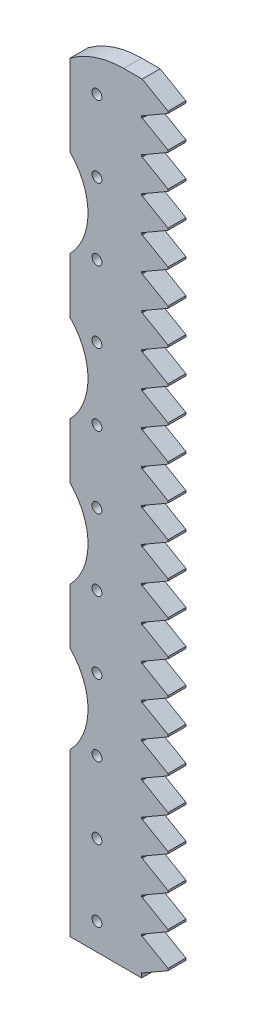
from build123d import *

# Parameters (mm, degrees)
SKETCH1_W           = 25.4
SKETCH1_H           = 276.225
BOSS_EXTRUDE1_DEPTH = 6.35
CUT_EXTRUDE1_DEPTH  = 278.463030195
SKETCH3_R           = 1.75
CUT_EXTRUDE2_DEPTH  = 278.463030195
LPATTERN1_COUNT     = 11
LPATTERN1_PITCH     = 25.4
SKETCH4_R           = 22.225
CUT_EXTRUDE3_DEPTH  = 278.463030195
LPATTERN2_COUNT     = 4
LPATTERN2_PITCH     = 50.8
BOSS_EXTRUDE2_DEPTH = 6.35
LPATTERN3_START     = -5e-05
LPATTERN3_DEPTH     = 6.35005


# Read off the part's stored shape, not the designer's step: LPattern3
with BuildPart() as part:
    # Sketch1 → Boss-Extrude1 (new body)
    with BuildSketch(Plane.XY):
        with Locations((-12.7, 138.1125)):
            Rectangle(SKETCH1_W, SKETCH1_H)
    extrude(amount=BOSS_EXTRUDE1_DEPTH)

    # Sketch2 → Cut-Extrude1 (cut, through all)
    with BuildSketch(Plane.XY.offset(6.35)):
        with BuildLine():
            Line((-6.35, 276.225), (-25.4, 276.225))
            Line((-25.4, 276.225), (-25.4, 269.875))
            ThreePointArc((-25.4, 269.875), (-16.390231571, 274.595694713), (-6.35, 276.225))
        make_face()
    extrude(amount=-CUT_EXTRUDE1_DEPTH, mode=Mode.SUBTRACT)

    # Sketch3 → Cut-Extrude2 (cut, through all)
    with BuildSketch(Plane.XY.offset(6.35)):
        with Locations((-15.875, 263.525)):
            Circle(SKETCH3_R)
    cut_extrude2 = extrude(amount=-CUT_EXTRUDE2_DEPTH, mode=Mode.SUBTRACT)

    # LPattern1: Cut-Extrude2 ×11
    with Locations(*[(0, -i * LPATTERN1_PITCH, 0) for i in range(1, LPATTERN1_COUNT)]):
        add(cut_extrude2, mode=Mode.SUBTRACT)

    # Sketch4 → Cut-Extrude3 (cut, through all)
    with BuildSketch(Plane.XY.offset(6.35)):
        with Locations((-41.275, 225.425)):
            Circle(SKETCH4_R)
    cut_extrude3 = extrude(amount=-CUT_EXTRUDE3_DEPTH, mode=Mode.SUBTRACT)

    # LPattern2: Cut-Extrude3 ×4
    with Locations(*[(0, -i * LPATTERN2_PITCH, 0) for i in range(1, LPATTERN2_COUNT)]):
        add(cut_extrude3, mode=Mode.SUBTRACT)

    # Sketch5 → Boss-Extrude2 (add, through all)
    with BuildSketch(Plane.XY.offset(6.35)):
        Polygon((0.1905, 276.225), (9.3345, 270.945709139), (9.3345, 270.240265995), (0.1905, 264.960975133), (0, 264.960975133), (0, 276.225), align=None)
    extrude(amount=-BOSS_EXTRUDE2_DEPTH)

    # LPattern3 outline → LPattern3 (add)
    with BuildSketch(Plane.XY.offset(LPATTERN3_START)):
        Polygon((0.1905, 252.991507123), (9.3345, 258.270797985), (9.3345, 258.976241128), (0.1905, 264.25553199), (0, 264.25553199), (0, 252.991507123), align=None)
        Polygon((0.1905, 12.896703776), (0, 12.896703776), (0, 1.63267891), (0.1905, 1.63267891), (9.3345, 6.911969771), (9.3345, 7.617412915), align=None)
        Polygon((0.1905, 24.866171786), (0, 24.866171786), (0, 13.60214692), (0.1905, 13.60214692), (9.3345, 18.881437781), (9.3345, 19.586880925), align=None)
        Polygon((0.1905, 36.835639796), (0, 36.835639796), (0, 25.57161493), (0.1905, 25.57161493), (9.3345, 30.850905791), (9.3345, 31.556348935), align=None)
        Polygon((0.1905, 48.805107807), (0, 48.805107807), (0, 37.54108294), (0.1905, 37.54108294), (9.3345, 42.820373802), (9.3345, 43.525816945), align=None)
        Polygon((0.1905, 60.774575817), (0, 60.774575817), (0, 49.51055095), (0.1905, 49.51055095), (9.3345, 54.789841812), (9.3345, 55.495284955), align=None)
        Polygon((0.1905, 72.744043827), (0, 72.744043827), (0, 61.48001896), (0.1905, 61.48001896), (9.3345, 66.759309822), (9.3345, 67.464752966), align=None)
        Polygon((0.1905, 84.713511837), (0, 84.713511837), (0, 73.449486971), (0.1905, 73.449486971), (9.3345, 78.728777832), (9.3345, 79.434220976), align=None)
        Polygon((0.1905, 96.682979847), (0, 96.682979847), (0, 85.418954981), (0.1905, 85.418954981), (9.3345, 90.698245842), (9.3345, 91.403688986), align=None)
        Polygon((0.1905, 108.652447858), (0, 108.652447858), (0, 97.388422991), (0.1905, 97.388422991), (9.3345, 102.667713852), (9.3345, 103.373156996), align=None)
        Polygon((0.1905, 120.621915868), (0, 120.621915868), (0, 109.357891001), (0.1905, 109.357891001), (9.3345, 114.637181863), (9.3345, 115.342625006), align=None)
        Polygon((0.1905, 132.591383878), (0, 132.591383878), (0, 121.327359011), (0.1905, 121.327359011), (9.3345, 126.606649873), (9.3345, 127.312093016), align=None)
        Polygon((0.1905, 144.560851888), (0, 144.560851888), (0, 133.296827021), (0.1905, 133.296827021), (9.3345, 138.576117883), (9.3345, 139.281561027), align=None)
        Polygon((0.1905, 156.530319898), (0, 156.530319898), (0, 145.266295032), (0.1905, 145.266295032), (9.3345, 150.545585893), (9.3345, 151.251029037), align=None)
        Polygon((0.1905, 168.499787908), (0, 168.499787908), (0, 157.235763042), (0.1905, 157.235763042), (9.3345, 162.515053903), (9.3345, 163.220497047), align=None)
        Polygon((0.1905, 180.469255919), (0, 180.469255919), (0, 169.205231052), (0.1905, 169.205231052), (9.3345, 174.484521913), (9.3345, 175.189965057), align=None)
        Polygon((0.1905, 192.438723929), (0, 192.438723929), (0, 181.174699062), (0.1905, 181.174699062), (9.3345, 186.453989924), (9.3345, 187.159433067), align=None)
        Polygon((0.1905, 204.408191939), (0, 204.408191939), (0, 193.144167072), (0.1905, 193.144167072), (9.3345, 198.423457934), (9.3345, 199.128901077), align=None)
        Polygon((0.1905, 216.377659949), (0, 216.377659949), (0, 205.113635083), (0.1905, 205.113635083), (9.3345, 210.392925944), (9.3345, 211.098369088), align=None)
        Polygon((0.1905, 228.347127959), (0, 228.347127959), (0, 217.083103093), (0.1905, 217.083103093), (9.3345, 222.362393954), (9.3345, 223.067837098), align=None)
        Polygon((0.1905, 240.316595969), (0, 240.316595969), (0, 229.052571103), (0.1905, 229.052571103), (9.3345, 234.331861964), (9.3345, 235.037305108), align=None)
        Polygon((0.1905, 252.28606398), (0, 252.28606398), (0, 241.022039113), (0.1905, 241.022039113), (9.3345, 246.301329975), (9.3345, 247.006773118), align=None)
    extrude(amount=LPATTERN3_DEPTH)


solid = part.part
